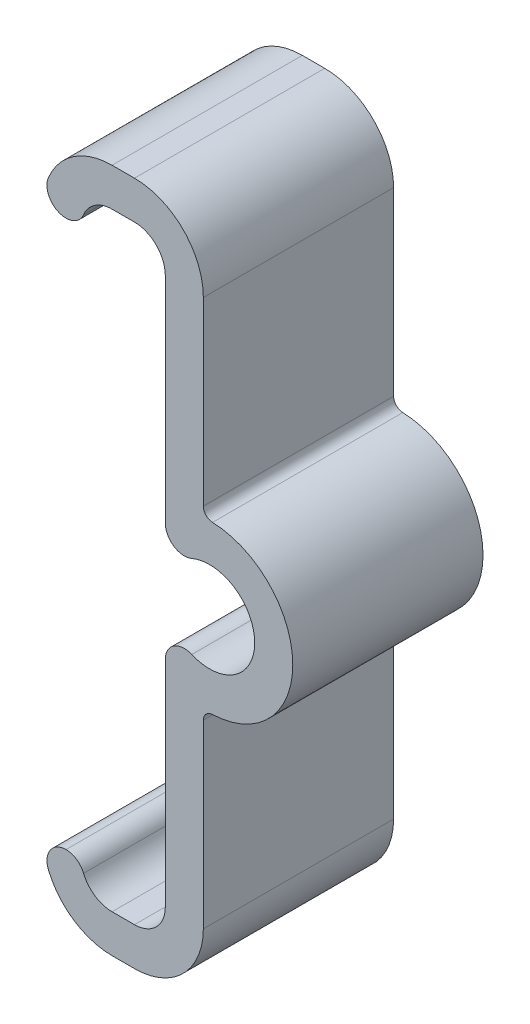
from build123d import *

# Parameters (mm, degrees)
BOSS_EXTRUDE1_DEPTH = 10
FILLET1_R           = 1
FILLET2_R           = 0.5
FILLET3_R           = 1


with BuildPart() as part:
    # Sketch1 → Boss-Extrude1 (new body)
    with BuildSketch(Plane.XY):
        with BuildLine():
            Line((0.05, 14.37), (0.05, 3.706076092))
            ThreePointArc((0.05, 3.706076092), (1.009905384, 4.156578123), (2.05, 4.362911872))
            Line((2.05, 4.362911872), (2.05, 14.37))
            ThreePointArc((2.05, 14.37), (0.989726548, 16.929726548), (-1.57, 17.99))
            Line((-1.57, 17.99), (-2.748, 17.99))
            ThreePointArc((-2.748, 17.99), (-5.307726548, 16.929726548), (-6.368, 14.37))
            Line((-6.368, 14.37), (-4.368, 14.37))
            ThreePointArc((-4.368, 14.37), (-3.893512986, 15.515512986), (-2.748, 15.99))
            Line((-2.748, 15.99), (-1.57, 15.99))
            ThreePointArc((-1.57, 15.99), (-0.424487014, 15.515512986), (0.05, 14.37))
        make_face()
        with BuildLine():
            Line((0.05, -0.484767986), (0.05, -3.706076092))
            ThreePointArc((0.05, -3.706076092), (1.009905384, -4.156578123), (2.05, -4.362911872))
            Line((2.05, -4.362911872), (2.05, -2.352658071))
            ThreePointArc((2.05, -2.352658071), (0.753926793, -1.73572655), (0.05, -0.484767986))
        make_face()
        with BuildLine():
            ThreePointArc((2.05, 4.362911872), (1.009905384, 4.156578123), (0.05, 3.706076092))
            Line((0.05, 3.706076092), (0.05, 0.484767986))
            ThreePointArc((0.05, 0.484767986), (0.753926793, 1.73572655), (2.05, 2.352658071))
            Line((2.05, 2.352658071), (2.05, 4.362911872))
        make_face()
        with BuildLine():
            Line((2.05, -2.352658071), (2.05, -4.362911872))
            ThreePointArc((2.05, -4.362911872), (5.351470225, -3.206438835), (6.75, 0))
            ThreePointArc((6.75, 0), (5.351470225, 3.206438835), (2.05, 4.362911872))
            Line((2.05, 4.362911872), (2.05, 2.352658071))
            ThreePointArc((2.05, 2.352658071), (3.935248378, 1.790600458), (4.75, 0))
            ThreePointArc((4.75, 0), (3.935248378, -1.790600458), (2.05, -2.352658071))
        make_face()
        with BuildLine():
            Line((-1.57, -15.99), (-2.748, -15.99))
            ThreePointArc((-2.748, -15.99), (-3.893512986, -15.515512986), (-4.368, -14.37))
            Line((-4.368, -14.37), (-6.368, -14.37))
            ThreePointArc((-6.368, -14.37), (-5.307726548, -16.929726548), (-2.748, -17.99))
            Line((-2.748, -17.99), (-1.57, -17.99))
            ThreePointArc((-1.57, -17.99), (0.989726548, -16.929726548), (2.05, -14.37))
            Line((2.05, -14.37), (2.05, -4.362911872))
            ThreePointArc((2.05, -4.362911872), (1.009905384, -4.156578123), (0.05, -3.706076092))
            Line((0.05, -3.706076092), (0.05, -14.37))
            ThreePointArc((0.05, -14.37), (-0.424487014, -15.515512986), (-1.57, -15.99))
        make_face()
    extrude(amount=BOSS_EXTRUDE1_DEPTH)

    # Fillet1
    fillet1_edges = [part.edges().sort_by_distance(p)[0] for p in [
        (0.05, -0.484767986, 5),
        (0.05, 0.484767986, 5),
    ]]
    fillet(fillet1_edges, radius=FILLET1_R)

    # Fillet2
    fillet2_edges = [part.edges().sort_by_distance(p)[0] for p in [
        (2.05, 4.362911872, 5),
        (2.05, -4.362911872, 5),
    ]]
    fillet(fillet2_edges, radius=FILLET2_R)

    # Fillet3
    fillet3_edges = [part.edges().sort_by_distance(p)[0] for p in [
        (-6.368, 14.37, 5),
        (-4.368, 14.37, 5),
        (-6.368, -14.37, 5),
        (-4.368, -14.37, 5),
    ]]
    fillet(fillet3_edges, radius=FILLET3_R - 0.0001)  # a hair under: the kernel refuses the full size


solid = part.part
